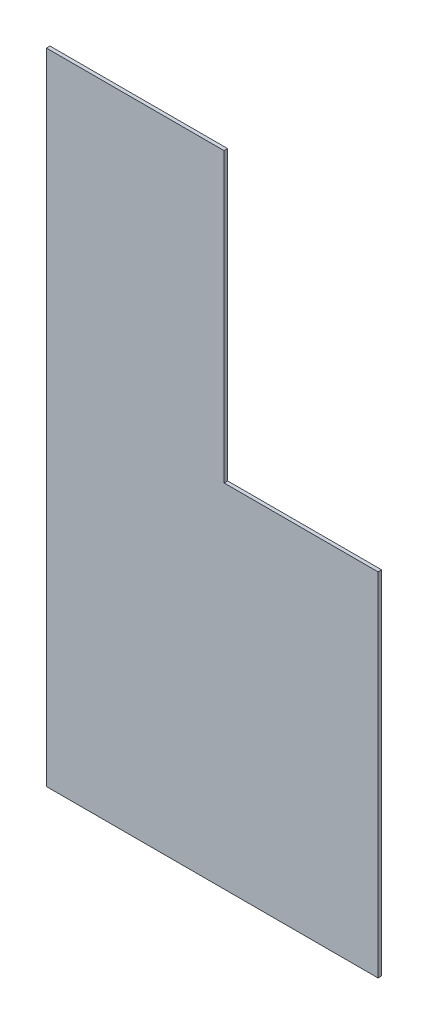
from build123d import *

# Parameters (mm, degrees)
BOSS_EXTRU_1_DEPTH = 3


with BuildPart() as part:
    # Esquisse1 → Boss.-Extru.1 (new body)
    with BuildSketch(Plane.XY):
        Polygon((228.461101291, -156.186500922), (228.461101291, -453.186500922), (-51.538898709, -453.186500922), (-51.538898709, 86.813499078), (98.461101291, 86.813499078), (98.461101291, -156.186500922), align=None)
    extrude(amount=BOSS_EXTRU_1_DEPTH)


solid = part.part
